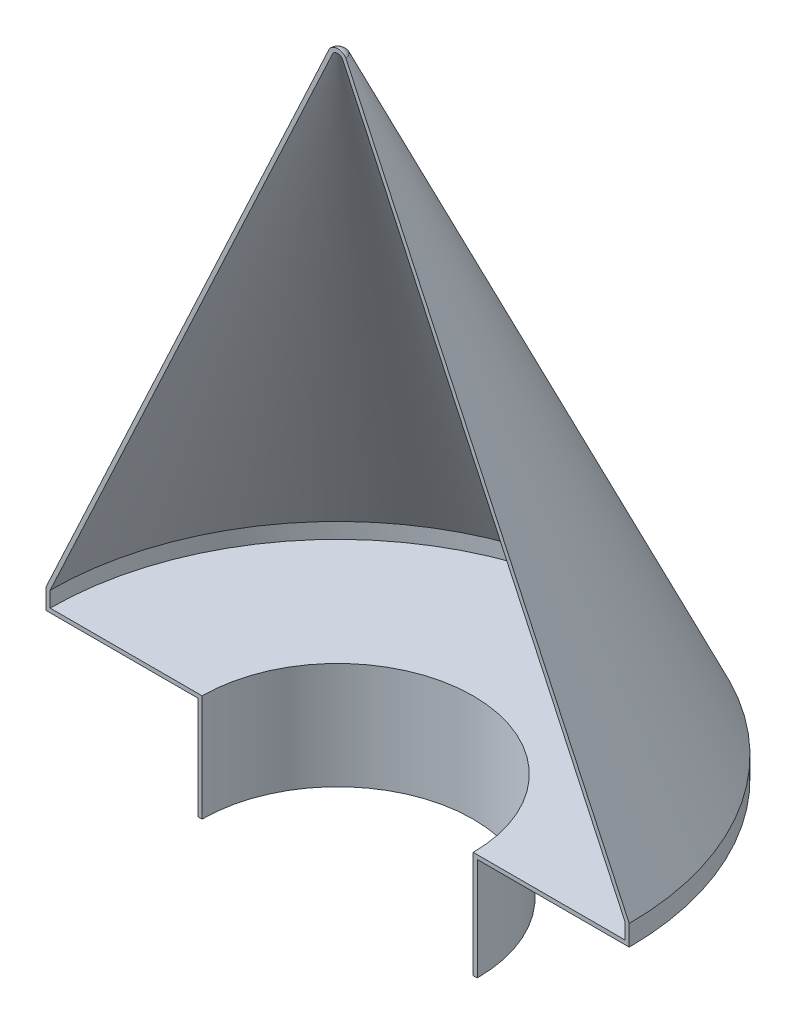
from build123d import *
from OCP.BRepAlgoAPI import BRepAlgoAPI_Cut
from OCP.TopTools import TopTools_ListOfShape

# Parameters (mm, degrees)
SHELL1_T           = -2
CUT_EXTRUDE1_DEPTH = 368.636026075


with BuildPart() as part:
    # Sketch3 → Revolve1 (revolve)
    with BuildSketch(Plane.XY):
        with BuildLine():
            Line((0, 0), (0, 307.94195503))
            ThreePointArc((0, 307.94195503), (2.236067977, 307.414090985), (4, 305.94195503))
            Line((4, 305.94195503), (142, 10))
            Line((142, 10), (142, 0))
            Line((142, 0), (68, 0))
            Line((68, 0), (68, -50))
            Line((68, -50), (0, -50))
            Line((0, -50), (0, 0))
        make_face()
    revolve(axis=Axis((0, 0, 0), (0, 1, 0)))

    # Shell1
    shell1_openings = [part.faces().sort_by_distance(p)[0] for p in [
        (0, -50, 0),
    ]]
    offset(amount=SHELL1_T, openings=shell1_openings, kind=Kind.INTERSECTION)


with BuildPart() as cut_extrude1_tool:
    # Sketch4 → Cut-Extrude1 (new, through all)
    with BuildSketch(Plane.XY):
        with BuildLine():
            Line((68, -50), (-68, -50))
            Line((-68, -50), (-68, 0))
            Line((-68, 0), (-142, 0))
            Line((-142, 0), (-142, 10))
            Line((-142, 10), (-3.999991292, 305.941966641))
            ThreePointArc((-3.999991292, 305.941966641), (7.257e-06, 307.94195503), (4, 305.94195503))
            Line((4, 305.94195503), (142, 10))
            Line((142, 10), (142, 0))
            Line((142, 0), (68, 0))
            Line((68, 0), (68, -50))
        make_face()
    extrude(amount=CUT_EXTRUDE1_DEPTH)


with BuildPart() as part_1:
    add(part.part)

    # Cut-Extrude1: cut by cut_extrude1_tool, with a tolerance
    cut_extrude1_stock = TopTools_ListOfShape()
    cut_extrude1_stock.Append(part_1.part.wrapped)
    cut_extrude1_tools = TopTools_ListOfShape()
    cut_extrude1_tools.Append(cut_extrude1_tool.part.wrapped)
    cut_extrude1_cut = BRepAlgoAPI_Cut()
    cut_extrude1_cut.SetArguments(cut_extrude1_stock)
    cut_extrude1_cut.SetTools(cut_extrude1_tools)
    cut_extrude1_cut.SetFuzzyValue(0.00001)
    cut_extrude1_cut.Build()
    add(Compound.cast(cut_extrude1_cut.Shape()).solids(), mode=Mode.REPLACE)


solid = part_1.part
